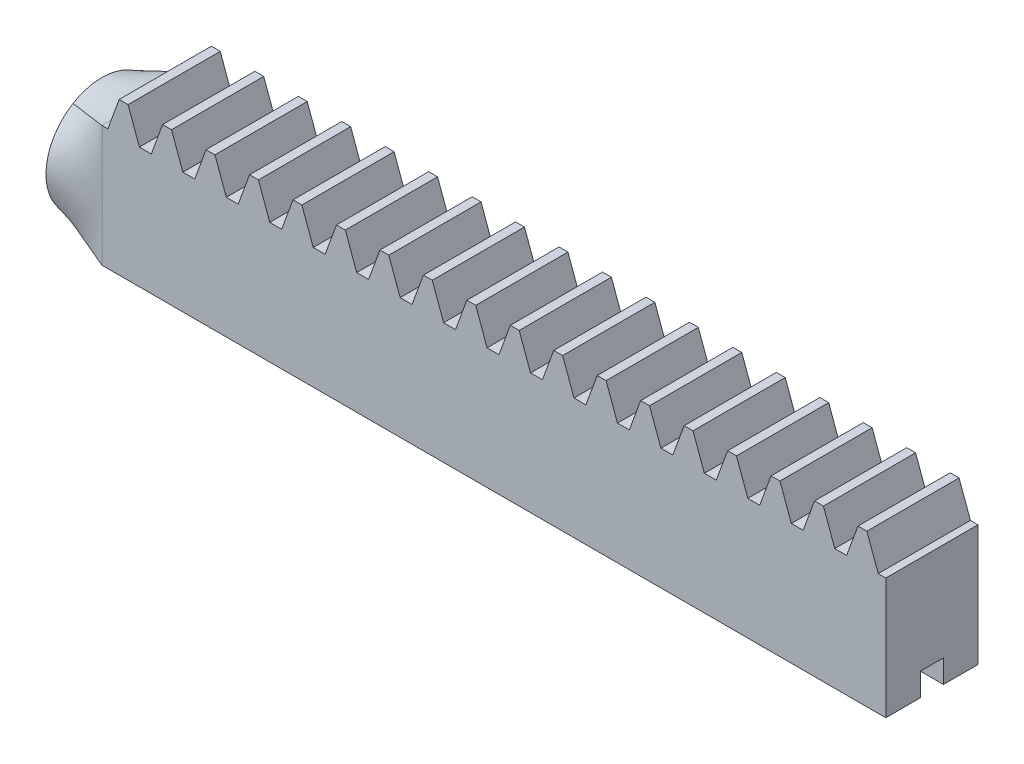
from build123d import *

# Parameters (mm, degrees)
BLANKSKE_W         = 17
BLANKSKE_H         = 3.3
BLANK_DEPTH        = 2
TOOTHCUTSIM_DEPTH  = 18.432441022
TEETHCUTS_COUNT    = 19
TEETHCUTS_PITCH    = 0.942477795
SKETCH1_W          = 0.5
SKETCH1_H          = 0.5
CUT_EXTRUDE1_DEPTH = 18.432441022


with BuildPart() as part:
    # BlankSke → Blank (new body)
    with BuildSketch(Plane.XY):
        with Locations((8.5, 1.65)):
            Rectangle(BLANKSKE_W, BLANKSKE_H)
    extrude(amount=-BLANK_DEPTH)

    # TooCutSkeSim → ToothCutSim (cut, through all)
    with BuildSketch(Plane.XY):
        Polygon((0.129130611, 2.625), (-0.129130611, 2.625), (-0.384055363, 3.3254), (0.384055363, 3.3254), align=None)
    toothcutsim = extrude(amount=-TOOTHCUTSIM_DEPTH, mode=Mode.SUBTRACT)

    # TeethCuts: ToothCutSim ×19
    with Locations(*[(i * TEETHCUTS_PITCH, 0, 0) for i in range(1, TEETHCUTS_COUNT)]):
        add(toothcutsim, mode=Mode.SUBTRACT)

    # Sketch1 → Cut-Extrude1 (cut, through all)
    with BuildSketch(Plane(origin=(17, 0, 0), x_dir=(0, 0, -1), z_dir=(1, 0, 0))):
        with Locations((1, 0.25)):
            Rectangle(SKETCH1_W, SKETCH1_H)
    extrude(amount=-CUT_EXTRUDE1_DEPTH, mode=Mode.SUBTRACT)

    # Loft1: read off the stored shape, not the designer's step
    # Loft1: loft between two sections, ruled curve by curve
    loft1_from = [
        Edge.make_bspline([(-1, 2.321360982, -1.672573988), (-1, 2.386469579, -1.574911092), (-1, 2.485564206, -1.365149558), (-1, 2.540372571, -1.027786651), (-1, 2.500881486, -0.688289756), (-1, 2.411377214, -0.474260245), (-1, 2.350753212, -0.373752031)], [0, 0, 0, 0, 0.25, 0.5, 0.75, 1, 1, 1, 1], 3),
        Edge.make_bspline([(-1, 2.350753212, -0.373752031), (-1, 2.25171936, -0.20956433), (-1, 1.98438986, 0.062051662), (-1, 1.433501665, 0.252036945), (-1, 0.856426864, 0.171062344), (-1, 0.542030673, -0.044333441), (-1, 0.413387868, -0.186517595)], [0, 0, 0, 0, 0.25, 0.5, 0.75, 1, 1, 1, 1], 3),
        Edge.make_bspline([(-1, 0.455133028, -1.857366972), (-1, 0.583554487, -1.985788432), (-1, 0.889022109, -2.17852057), (-1, 1.435989481, -2.247122683), (-1, 1.958881136, -2.07258365), (-1, 2.220618901, -1.82368711), (-1, 2.321360982, -1.672573988)], [0, 0, 0, 0, 0.25, 0.5, 0.75, 1, 1, 1, 1], 3),
        Edge.make_bspline([(-1, 0.413387868, -0.186517595), (-1, 0.375553122, -0.228334946), (-1, 0.306844772, -0.315959172), (-1, 0.223712602, -0.45807693), (-1, 0.160449665, -0.610084219), (-1, 0.131966282, -0.717729651), (-1, 0.103213139, -0.868683652), (-1, 0.089654768, -1.065841054), (-1, 0.141987611, -1.360301974), (-1, 0.264270675, -1.633156172), (-1, 0.386349144, -1.788583089), (-1, 0.455133028, -1.857366972)], [0, 0, 0, 0, 0.0917447, 0.183489399, 0.275234099, 0.366978799, 0.366978799, 0.525234099, 0.683489399, 0.8417447, 1, 1, 1, 1], 3),
    ]
    loft1_to = [
        Edge.make_bspline([(0, 2.625, -2), (0, 2.625, -1.833333333), (0, 2.625, -1.5), (0, 2.625, -1), (0, 2.625, -0.5), (0, 2.625, -0.166666667), (0, 2.625, 0)], [0, 0, 0, 0, 0.25, 0.5, 0.75, 1, 1, 1, 1], 3),
        Edge.make_bspline([(0, 2.625, 0), (0, 2.40625, 0), (0, 1.96875, 0), (0, 1.3125, 0), (0, 0.65625, 0), (0, 0.21875, 0), (0, 0, 0)], [0, 0, 0, 0, 0.25, 0.5, 0.75, 1, 1, 1, 1], 3),
        Edge.make_bspline([(0, 0, -2), (0, 0.21875, -2), (0, 0.65625, -2), (0, 1.3125, -2), (0, 1.96875, -2), (0, 2.40625, -2), (0, 2.625, -2)], [0, 0, 0, 0, 0.25, 0.5, 0.75, 1, 1, 1, 1], 3),
        Edge.make_bspline([(0, 0, 0), (0, 0, -0.061163133), (0, 0, -0.185429777), (0, 0, -0.375), (0, 0, -0.564570223), (0, 0, -0.688836867), (0, 0, -0.855503534), (0, 0, -1.064467717), (0, 0, -1.375), (0, 0, -1.685532283), (0, 0, -1.894496466), (0, 0, -2)], [0, 0, 0, 0, 0.0917447, 0.183489399, 0.275234099, 0.366978799, 0.366978799, 0.525234099, 0.683489399, 0.8417447, 1, 1, 1, 1], 3),
    ]
    loft1 = Solid(Shell([*[Face.make_surface_from_curves(loft1_from[k], loft1_to[k]) for k in range(4)], Face(Wire(loft1_from)), Face(Wire(loft1_to))]))
    add(loft1)


solid = part.part
